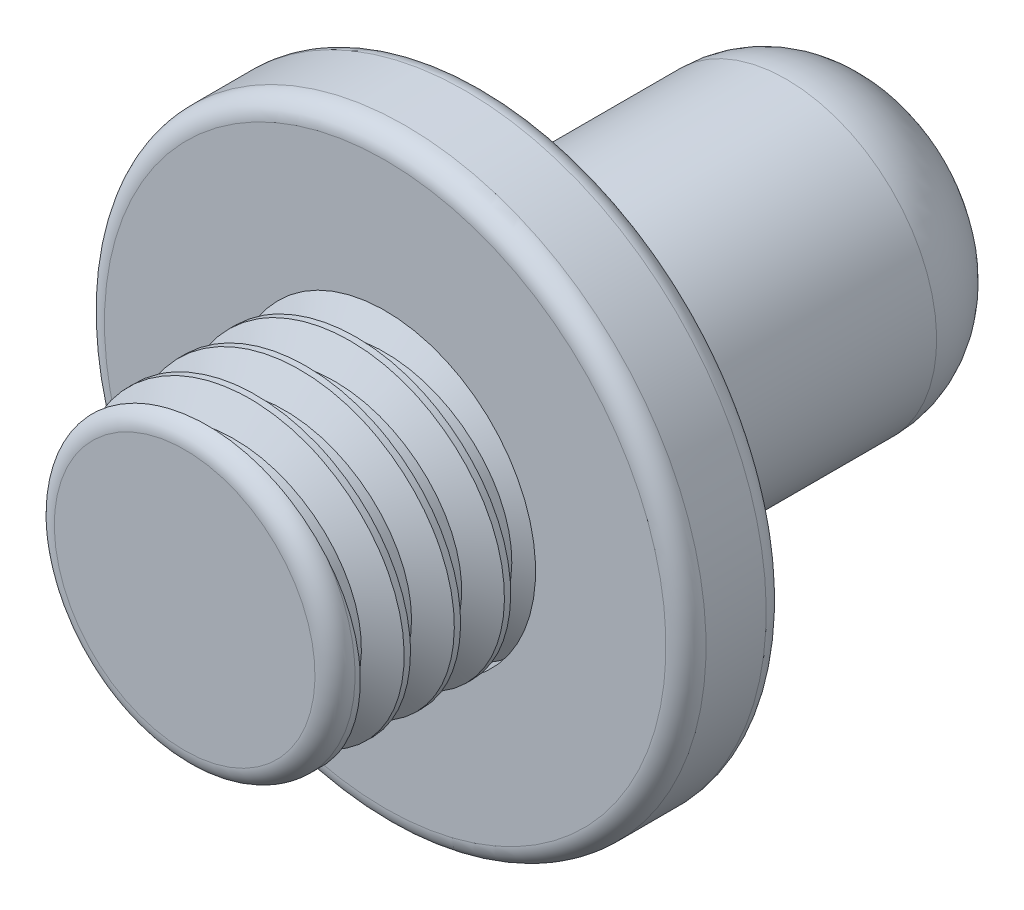
from build123d import *

# Parameters (mm, degrees)
FILLET1_R     = 1
FILLET2_R     = 0.2
THREAD1_PITCH = 0.5
FILLET3_R     = 0.2


with BuildPart() as part:
    # Sketch1 → Revolve1 (revolve)
    with BuildSketch(Plane(origin=(0, 0, 0), x_dir=(0, 0, -1), z_dir=(1, 0, 0))):
        Polygon((0, 0), (-7, 0), (-7, 1.5), (-5, 1.5), (-5, 3), (-4, 3), (-4, 1.5), (0, 1.5), align=None)
    revolve(axis=Axis((0, 0, 0), (0, 0, 1)))

    # Fillet1
    fillet1_edges = [part.edges().sort_by_distance(p)[0] for p in [
        (0, -1.5, 0),
    ]]
    fillet(fillet1_edges, radius=FILLET1_R)

    # Fillet2
    fillet2_edges = [part.edges().sort_by_distance(p)[0] for p in [
        (0, -1.5, 7),
    ]]
    fillet(fillet2_edges, radius=FILLET2_R)

    # Thread1: the profile of Thread Profile1 profile screwed along a right-hand helix of 4 turns, 6 arcs to a turn; built about Z, then put on its axis
    thread1_z = Axis((0, 0, 0), (0, 0, 1))
    thread1_corners = [(1.5003, 0, -0.000173205), (1.5003, 0, 0.437673204), (1.229367063, 0, 0.281249999), (1.229367063, 0, 0.156249999)]
    with BuildLine(mode=Mode.PRIVATE) as thread1_profile:
        Line(thread1_corners[0], thread1_corners[1])
        Line(thread1_corners[1], thread1_corners[2])
        Line(thread1_corners[2], thread1_corners[3])
        Line(thread1_corners[3], thread1_corners[0])
    thread1_cap = Face(thread1_profile.wire())
    thread1_turn_angles = [0, 30, 60, 90, 120, 150, 180, 210, 240, 270, 300, 330, 360]
    thread1_turn_weights = [1, 0.8660254037844387, 1, 0.8660254037844387, 1, 0.8660254037844387, 1, 0.8660254037844387, 1, 0.8660254037844387, 1, 0.8660254037844387, 1]
    thread1_turn_rails = [Edge.make_bspline([Vector(p[0], p[1], 0).rotate(thread1_z, thread1_turn_angles[k]) / thread1_turn_weights[k] + Vector(0, 0, p[2] + THREAD1_PITCH * thread1_turn_angles[k] / 360) for k in range(13)], [0, 0, 0, 1, 1, 2, 2, 3, 3, 4, 4, 5, 5, 6, 6, 6], 2, thread1_turn_weights) for p in thread1_corners]
    thread1_turn_sides = [Face.make_surface_from_curves(thread1_turn_rails[p[0]], thread1_turn_rails[p[1]]) for p in [(0, 1), (1, 2), (2, 3), (3, 0)]]
    thread1 = Plane(origin=(0, 0, 7), x_dir=(-1, 0, 0), z_dir=(0, 0, -1)) * Solid(Shell([*[p.moved(Location((0, 0, THREAD1_PITCH * i))) for i in range(4) for p in thread1_turn_sides], thread1_cap, thread1_cap.rotate(thread1_z, 1440).moved(Location((0, 0, THREAD1_PITCH * 1440 / 360)))]))
    add(thread1, mode=Mode.SUBTRACT)

    # Fillet3
    fillet3_edges = [part.edges().sort_by_distance(p)[0] for p in [
        (0, -3, 4),
        (0, -3, 5),
    ]]
    fillet(fillet3_edges, radius=FILLET3_R)


solid = part.part
